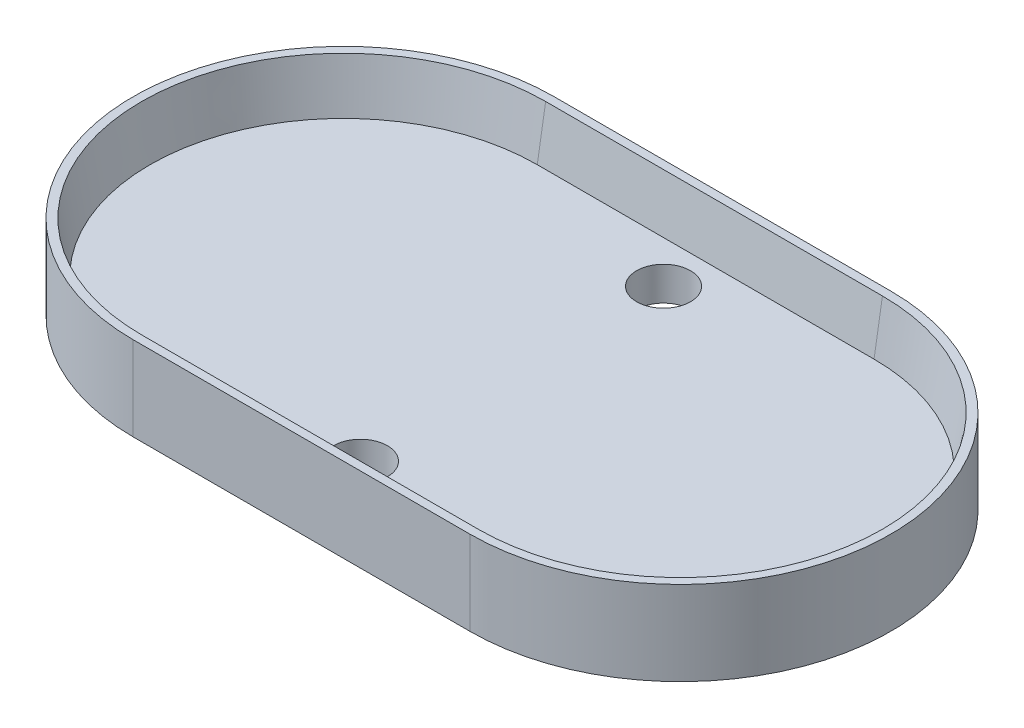
from build123d import *

# Parameters (mm, degrees)
BOSS_EXTRUDE1_DEPTH = 2
BOSS_EXTRUDE2_DEPTH = 3
CHAMFER1_SIZE       = 0.5
CHAMFER1_SIZE_2     = 3
SKETCH3_R           = 1.6
CUT_EXTRUDE1_DEPTH  = 27.220221204


with BuildPart() as part:
    # Sketch1 → Boss-Extrude1 (new body)
    with BuildSketch(Plane(origin=(0, 0, 0), x_dir=(1, 0, 0), z_dir=(0, 1, 0))):
        with BuildLine():
            Line((-10, 12.5), (10, 12.5))
            ThreePointArc((10, 12.5), (22.5, 0), (10, -12.5))
            Line((10, -12.5), (-10, -12.5))
            ThreePointArc((-10, -12.5), (-22.5, 0), (-10, 12.5))
        make_face()
    extrude(amount=BOSS_EXTRUDE1_DEPTH)

    # Sketch2 → Boss-Extrude2 (add)
    with BuildSketch(Plane(origin=(0, 2, 0), x_dir=(1, 0, 0), z_dir=(0, 1, 0))):
        with BuildLine():
            Line((10, 12.5), (-10, 12.5))
            ThreePointArc((-10, 12.5), (-22.5, 0), (-10, -12.5))
            Line((-10, -12.5), (10, -12.5))
            ThreePointArc((10, -12.5), (22.5, 0), (10, 12.5))
        make_face()
        with BuildLine():
            Line((-10, -11.5), (10, -11.5))
            ThreePointArc((10, -11.5), (21.5, 0), (10, 11.5))
            Line((10, 11.5), (-10, 11.5))
            ThreePointArc((-10, 11.5), (-21.5, 0), (-10, -11.5))
        make_face(mode=Mode.SUBTRACT)
    extrude(amount=BOSS_EXTRUDE2_DEPTH)

    # Chamfer1
    # the kernel refuses this chamfer: 3, 0.5 mm, written as the material it takes off along each edge
    with BuildSketch(Plane(origin=(-10, 5, 11.5), x_dir=(0, 0.2220622368174743, 0.9750324932942593), z_dir=(1, 0, 0))) as chamfer1_piece_1_section:
        Polygon((CHAMFER1_SIZE * 0.975032493294, CHAMFER1_SIZE * 0.222062236817), (-CHAMFER1_SIZE_2 * 0.222062236817, CHAMFER1_SIZE_2 * 0.975032493294), (0, 0), align=None)
    chamfer1_piece_1 = extrude(amount=20, mode=Mode.PRIVATE)
    chamfer1_piece_1 = split(chamfer1_piece_1, bisect_by=Plane(origin=(0, 2, 11.634388756), z_dir=(0, 1, 0)), keep=Keep.TOP, mode=Mode.PRIVATE)
    add(chamfer1_piece_1, mode=Mode.SUBTRACT)
    with BuildSketch(Plane(origin=(10, 5, 0), x_dir=(0, 0, 1), z_dir=(-1, 0, 0))) as chamfer1_piece_2_section:
        Polygon((11.5 + CHAMFER1_SIZE, 0), (11.5, -CHAMFER1_SIZE_2), (11.5, 0), align=None)
    chamfer1_piece_2 = revolve(axis=Axis((10, 5, 0), (0, 1, 0)), revolution_arc=180, mode=Mode.PRIVATE)
    chamfer1_piece_2 = split(chamfer1_piece_2, bisect_by=Plane(origin=(21.727349814, 2, 0), z_dir=(0, 1, 0)), keep=Keep.TOP, mode=Mode.PRIVATE)
    add(chamfer1_piece_2, mode=Mode.SUBTRACT)
    with BuildSketch(Plane(origin=(10, 5, -11.5), x_dir=(0, 0.2220622368174743, -0.9750324932942593), z_dir=(-1, 0, 0))) as chamfer1_piece_3_section:
        Polygon((CHAMFER1_SIZE * 0.975032493294, CHAMFER1_SIZE * 0.222062236817), (-CHAMFER1_SIZE_2 * 0.222062236817, CHAMFER1_SIZE_2 * 0.975032493294), (0, 0), align=None)
    chamfer1_piece_3 = extrude(amount=20, mode=Mode.PRIVATE)
    chamfer1_piece_3 = split(chamfer1_piece_3, bisect_by=Plane(origin=(0, 2, -11.634388756), z_dir=(0, 1, 0)), keep=Keep.TOP, mode=Mode.PRIVATE)
    add(chamfer1_piece_3, mode=Mode.SUBTRACT)
    with BuildSketch(Plane(origin=(-10, 5, 0), x_dir=(0, 0, -1), z_dir=(1, 0, 0))) as chamfer1_piece_4_section:
        Polygon((11.5 + CHAMFER1_SIZE, 0), (11.5, -CHAMFER1_SIZE_2), (11.5, 0), align=None)
    chamfer1_piece_4 = revolve(axis=Axis((-10, 5, 0), (0, 1, 0)), revolution_arc=180, mode=Mode.PRIVATE)
    chamfer1_piece_4 = split(chamfer1_piece_4, bisect_by=Plane(origin=(-21.727349812, 2, 0), z_dir=(0, 1, 0)), keep=Keep.TOP, mode=Mode.PRIVATE)
    add(chamfer1_piece_4, mode=Mode.SUBTRACT)

    # Sketch3 → Cut-Extrude1 (cut, through all)
    with BuildSketch(Plane.XZ):
        with Locations(Location((0, -9, 0), (0, 0, 270))):
            Circle(SKETCH3_R)
        with Locations(Location((0, 9, 0), (0, 0, 270))):
            Circle(SKETCH3_R)
    extrude(amount=-CUT_EXTRUDE1_DEPTH, mode=Mode.SUBTRACT)


solid = part.part
